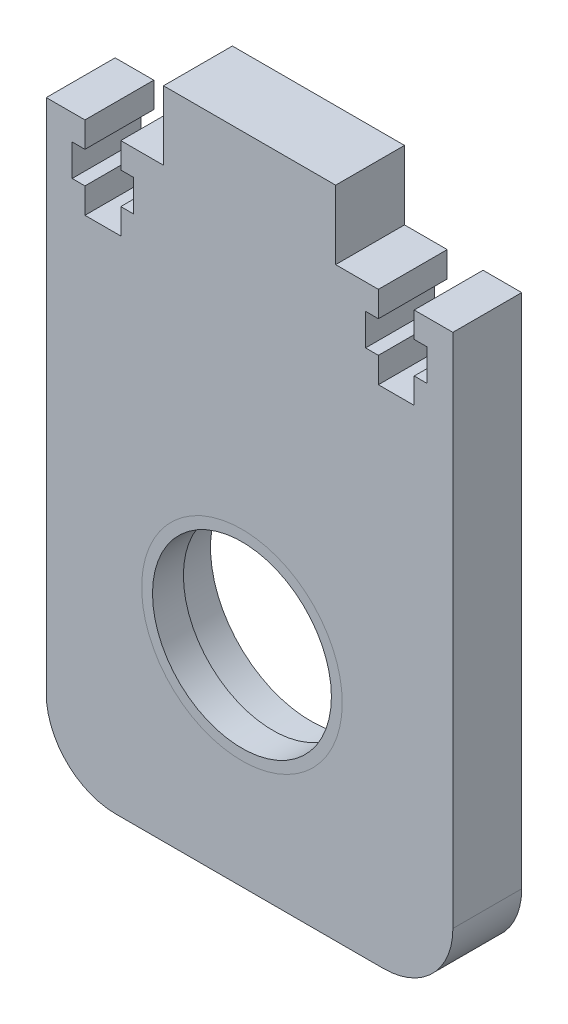
from build123d import *

# Parameters (mm, degrees)
SKETCH12_W           = 75
SKETCH12_H           = 108.03
BOSS_EXTRUDE10_DEPTH = 12.7
SKETCH25_R           = 18.5
CUT_EXTRUDE1_DEPTH   = 176.029338866
SKETCH26_R           = 18.5
SKETCH26_R_2         = 16.5
BOSS_EXTRUDE15_DEPTH = 5.7
FILLET1_R            = 12.8
CUT_EXTRUDE2_DEPTH   = 176.029338866
BOSS_EXTRUDE16_DEPTH = 12.7


with BuildPart() as part:
    # Sketch12 → Boss-Extrude10 (new body)
    with BuildSketch(Plane.XY):
        with Locations((99.625849364, 54.015)):
            Rectangle(SKETCH12_W, SKETCH12_H)
    extrude(amount=BOSS_EXTRUDE10_DEPTH)

    # Sketch25 → Cut-Extrude1 (cut, through all)
    with BuildSketch(Plane.XY.offset(12.7)):
        with Locations((98.219620603, 38.627603634)):
            Circle(SKETCH25_R)
    extrude(amount=-CUT_EXTRUDE1_DEPTH, mode=Mode.SUBTRACT)

    # Fillet1
    fillet1_edges = [part.edges().sort_by_distance(p)[0] for p in [
        (137.125849364, 0, 6.35),
        (62.125849364, 0, 6.35),
    ]]
    fillet(fillet1_edges, radius=FILLET1_R)

    # Sketch27 → Cut-Extrude2 (cut, through all)
    with BuildSketch(Plane(origin=(0, 0, 0), x_dir=(-1, 0, 0), z_dir=(0, 0, -1))):
        Polygon((-123.386140427, 103.331), (-123.386140427, 108.03), (-129.990140427, 108.03), (-129.990140427, 103.331), (-132.352140427, 103.331), (-132.352140427, 97.489), (-129.990140427, 97.489), (-129.990140427, 92.79), (-123.386140427, 92.79), (-123.386140427, 97.489), (-121.024140427, 97.489), (-121.024140427, 103.331), align=None)
        Polygon((-69.261558301, 103.331), (-69.261558301, 108.03), (-75.865558301, 108.03), (-75.865558301, 103.331), (-78.227558301, 103.331), (-78.227558301, 97.489), (-75.865558301, 97.489), (-75.865558301, 92.79), (-69.261558301, 92.79), (-69.261558301, 97.489), (-66.899558301, 97.489), (-66.899558301, 103.331), align=None)
    extrude(amount=-CUT_EXTRUDE2_DEPTH, mode=Mode.SUBTRACT)

    # Sketch28 → Boss-Extrude16 (add)
    with BuildSketch(Plane(origin=(0, 108.03, 0), x_dir=(1, 0, 0), z_dir=(0, 1, 0))):
        Polygon((99.625849364, 0), (83.750849364, 0), (83.750849364, -12.7), (115.500849364, -12.7), (115.500849364, 0), align=None)
    extrude(amount=BOSS_EXTRUDE16_DEPTH)


with BuildPart() as body_2:
    # Sketch26 → Boss-Extrude15 (new body)
    with BuildSketch(Plane.XY.offset(12.7)):
        with Locations((98.219620603, 38.627603634)):
            Circle(SKETCH26_R)
        with Locations((98.219620603, 38.627603634)):
            Circle(SKETCH26_R_2, mode=Mode.SUBTRACT)
    extrude(amount=-BOSS_EXTRUDE15_DEPTH)


solid = Compound([part.part, body_2.part])
